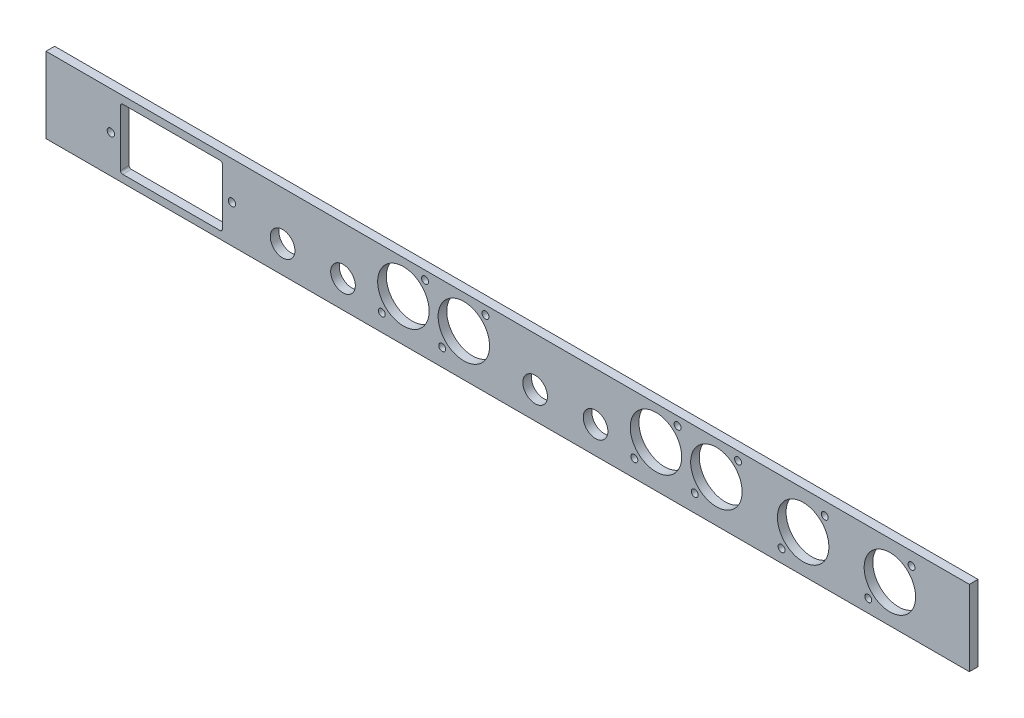
from build123d import *

# Parameters (mm, degrees)
SKETCH1_W           = 427
SKETCH1_H           = 35
BOSS_EXTRUDE1_DEPTH = 4
SKETCH2_R           = 11.9
SKETCH2_R_2         = 1.6
SKETCH2_R_3         = 5.7
SKETCH2_R_4         = 1.7
CUT_EXTRUDE1_DEPTH  = 4


with BuildPart() as part:
    # Sketch1 → Boss-Extrude1 (new body)
    with BuildSketch(Plane.XY):
        Rectangle(SKETCH1_W, SKETCH1_H)
    extrude(amount=BOSS_EXTRUDE1_DEPTH)

    # Sketch2 → Cut-Extrude1 (cut)
    with BuildSketch(Plane.XY.offset(4)):
        with Locations((-20.271803936, 2)):
            Circle(SKETCH2_R)
        with Locations((-30.271803936, -9.5)):
            Circle(SKETCH2_R_2)
        with Locations((-10.271803936, 13.5)):
            Circle(SKETCH2_R_2)
        with Locations((-58.211803936, -9.5)):
            Circle(SKETCH2_R_2)
        with Locations((-48.211803936, 2)):
            Circle(SKETCH2_R)
        with Locations((-38.211803936, 13.5)):
            Circle(SKETCH2_R_2)
        with Locations((126.64, -11.5)):
            Circle(SKETCH2_R_2)
        with Locations((146.64, 11.5)):
            Circle(SKETCH2_R_2)
        with Locations((136.64, 0)):
            Circle(SKETCH2_R)
        with Locations((166.76, -11.5)):
            Circle(SKETCH2_R_2)
        with Locations((186.76, 11.5)):
            Circle(SKETCH2_R_2)
        with Locations((176.76, 0)):
            Circle(SKETCH2_R)
        with Locations((-76.151803936, -4.865)):
            Circle(SKETCH2_R_3)
        with Locations((-104.091803936, -4.865)):
            Circle(SKETCH2_R_3)
        with Locations((40.64, -4.865)):
            Circle(SKETCH2_R_3)
        with Locations((86.52, -9.5)):
            Circle(SKETCH2_R_2)
        with Locations((106.52, 13.5)):
            Circle(SKETCH2_R_2)
        with Locations((68.58, 2)):
            Circle(SKETCH2_R)
        with Locations((96.52, 2)):
            Circle(SKETCH2_R)
        with Locations((12.7, -4.865)):
            Circle(SKETCH2_R_3)
        with Locations((78.58, 13.5)):
            Circle(SKETCH2_R_2)
        with Locations((58.58, -9.5)):
            Circle(SKETCH2_R_2)
        with Locations((-127.5, 0)):
            Circle(SKETCH2_R_4)
        with Locations((-183.5, 0)):
            Circle(SKETCH2_R_4)
        with BuildLine():
            Line((-178.05, -14.05), (-132.95, -14.05))
            ThreePointArc((-132.95, -14.05), (-132.242893219, -13.757106781), (-131.95, -13.05))
            Line((-131.95, -13.05), (-131.95, 13.05))
            ThreePointArc((-131.95, 13.05), (-132.242893219, 13.757106781), (-132.95, 14.05))
            Line((-132.95, 14.05), (-178.05, 14.05))
            ThreePointArc((-178.05, 14.05), (-178.757106781, 13.757106781), (-179.05, 13.05))
            Line((-179.05, 13.05), (-179.05, -13.05))
            ThreePointArc((-179.05, -13.05), (-178.757106781, -13.757106781), (-178.05, -14.05))
        make_face()
    extrude(amount=-CUT_EXTRUDE1_DEPTH, mode=Mode.SUBTRACT)


solid = part.part
